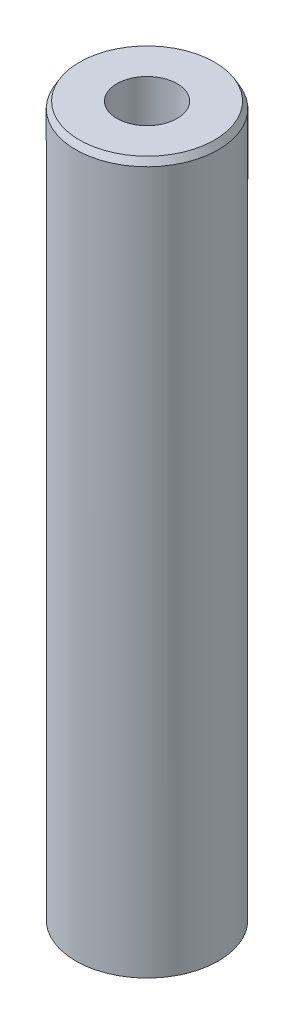
from build123d import *
from OCP.BRepFilletAPI import BRepFilletAPI_MakeChamfer

# Parameters (mm, degrees)
SKETCH1_R           = 60
BOSS_EXTRUDE1_DEPTH = 600
SKETCH2_R           = 25.380839498
CUT_EXTRUDE1_DEPTH  = 606.970296302
CHAMFER1_SIZE       = 5.481791925
CHAMFER1_SIZE2      = 3.164914044


with BuildPart() as part:
    # Sketch1 → Boss-Extrude1 (new body)
    with BuildSketch(Plane(origin=(0, 0, 0), x_dir=(1, 0, 0), z_dir=(0, 1, 0))):
        Circle(SKETCH1_R)
    extrude(amount=BOSS_EXTRUDE1_DEPTH)

    # Sketch2 → Cut-Extrude1 (cut, through all)
    with BuildSketch(Plane(origin=(0, 0, 0), x_dir=(1, 0, 0), z_dir=(0, 1, 0))):
        Circle(SKETCH2_R)
    extrude(amount=CUT_EXTRUDE1_DEPTH, mode=Mode.SUBTRACT)

    # Chamfer1: one chamfer whose edges measure the first distance from different faces: ONE call of the kernel's chamfer builder (chamfer() names one face for all edges)
    chamfer1_edges_1 = [part.edges().sort_by_distance(p)[0] for p in [
        (-60, 600, 0),
    ]]
    chamfer1_side_1 = [part.faces().sort_by_distance(p)[0] for p in [
        (-60, 300, 0),
    ]]
    chamfer1_edges_2 = [part.edges().sort_by_distance(p)[0] for p in [
        (-60, 0, 0),
    ]]
    chamfer1_side_2 = [part.faces().sort_by_distance(p)[0] for p in [
        (-58.302943725, 0, 0),
    ]]
    chamfer1 = BRepFilletAPI_MakeChamfer(part.part.solid().wrapped)
    for e in chamfer1_edges_1:
        chamfer1.Add(CHAMFER1_SIZE, CHAMFER1_SIZE2, e.wrapped, chamfer1_side_1[0].wrapped)  # the first distance lies on this face
    for e in chamfer1_edges_2:
        chamfer1.Add(CHAMFER1_SIZE, CHAMFER1_SIZE2, e.wrapped, chamfer1_side_2[0].wrapped)  # the first distance lies on this face
    add(Compound.cast(chamfer1.Shape()), mode=Mode.REPLACE)


solid = part.part
